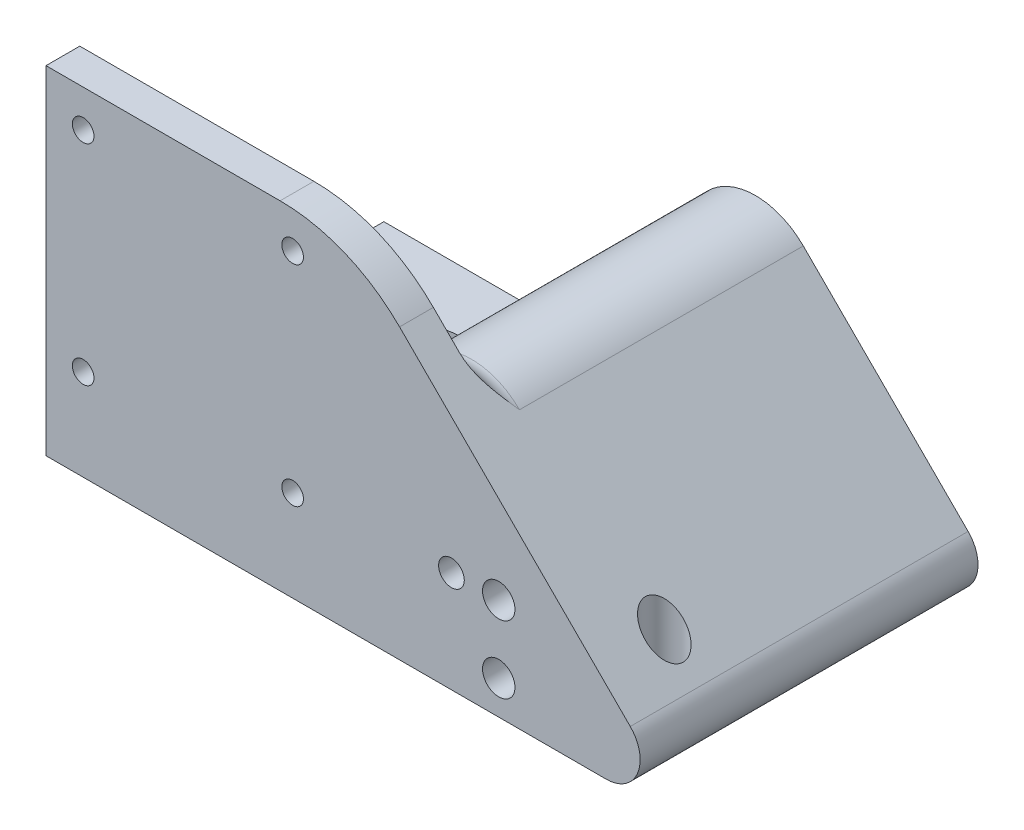
from build123d import *

# Parameters (mm, degrees)
SKETCH_1_R          = 1.6
SKETCH_1_R_2        = 12
EXTRUDE_1_DEPTH     = 5
SKETCH_4_W          = 45
SKETCH_4_H          = 50
SKETCH_4_R          = 1.6
EXTRUDE_4_DEPTH     = 5
SKETCH_5_W          = 50
SKETCH_5_H          = 50
EXTRUDE_5_DEPTH     = 50
SKETCH_6_R          = 2.4
SKETCH_6_R_2        = 1.9
CUT_EXTRUDE_1_DEPTH = 103.352332655
SKETCH_7_R          = 1.8
CUT_EXTRUDE_2_DEPTH = 94.898881782
SKETCH_8_R          = 2.8
CUT_EXTRUDE_3_DEPTH = 45
SKETCH_9_W          = 17
SKETCH_9_H          = 20
CUT_EXTRUDE_4_DEPTH = 45
CHAMFER_1_SIZE      = 50
FILLET_1_R          = 5
FILLET_4_R          = 10
FILLET_5_R          = 25
FILLET_6_R          = 3
FILLET_7_R          = 1.5


with BuildPart() as part:
    # 草图1 → 凸台-拉伸1 (new body)
    with BuildSketch(Plane(origin=(0, 0, 0), x_dir=(1, 0, 0), z_dir=(0, 1, 0))):
        Polygon((24, -24), (24, 21), (21, 21), (-21, 21), (-21, -21), (-21, -24), align=None)
        with Locations(Location((-15.5, 15.5, 0), (0, 0, 270))):
            Circle(SKETCH_1_R, mode=Mode.SUBTRACT)
        with Locations(Location((15.5, 15.5, 0), (0, 0, 270))):
            Circle(SKETCH_1_R, mode=Mode.SUBTRACT)
        with Locations(Location((-15.5, -15.5, 0), (0, 0, 270))):
            Circle(SKETCH_1_R, mode=Mode.SUBTRACT)
        with Locations(Location((15.5, -15.5, 0), (0, 0, 270))):
            Circle(SKETCH_1_R, mode=Mode.SUBTRACT)
        with Locations(Location((0, 0, 0), (0, 0, 270))):
            Circle(SKETCH_1_R_2, mode=Mode.SUBTRACT)
    extrude(amount=EXTRUDE_1_DEPTH)

    # 草图4 → 凸台-拉伸4 (add)
    with BuildSketch(Plane.XY.offset(24)):
        with Locations((1.5, 25)):
            Rectangle(SKETCH_4_W, SKETCH_4_H)
        with Locations((-15.5, 44.5)):
            Circle(SKETCH_4_R, mode=Mode.SUBTRACT)
        with Locations((15.5, 44.5)):
            Circle(SKETCH_4_R, mode=Mode.SUBTRACT)
        with Locations((-15.5, 13.5)):
            Circle(SKETCH_4_R, mode=Mode.SUBTRACT)
        with Locations((15.5, 13.5)):
            Circle(SKETCH_4_R, mode=Mode.SUBTRACT)
    extrude(amount=EXTRUDE_4_DEPTH)

    # 草图5 → 凸台-拉伸5 (add)
    with BuildSketch(Plane(origin=(24, 0, 0), x_dir=(0, 0, -1), z_dir=(1, 0, 0))):
        with Locations((-4, 25)):
            Rectangle(SKETCH_5_W, SKETCH_5_H)
    extrude(amount=EXTRUDE_5_DEPTH)

    # 草图6 → 切除-拉伸1 (cut, through all)
    with BuildSketch(Plane(origin=(0, 0, -21), x_dir=(-1, 0, 0), z_dir=(0, 0, -1))):
        with Locations((-46, 5)):
            Circle(SKETCH_6_R)
        with Locations((-46, 15)):
            Circle(SKETCH_6_R)
        with Locations((-39, 15)):
            Circle(SKETCH_6_R_2)
    extrude(amount=-CUT_EXTRUDE_1_DEPTH, mode=Mode.SUBTRACT)

    # 草图7 → 切除-拉伸2 (cut, through all)
    with BuildSketch(Plane.XZ):
        with Locations(Location((60.5, 19, 0), (0, 0, 270))):
            Circle(SKETCH_7_R)
    extrude(amount=-CUT_EXTRUDE_2_DEPTH, mode=Mode.SUBTRACT)

    # 草图8 → 切除-拉伸3 (cut)
    with BuildSketch(Plane(origin=(0, 50, 0), x_dir=(1, 0, 0), z_dir=(0, 1, 0))):
        with Locations(Location((60.5, -19, 0), (0, 0, 270))):
            Circle(SKETCH_8_R)
    extrude(amount=-CUT_EXTRUDE_3_DEPTH, mode=Mode.SUBTRACT)

    # 草图9 → 切除-拉伸4 (cut)
    with BuildSketch(Plane(origin=(0, 0, -21), x_dir=(-1, 0, 0), z_dir=(0, 0, -1))):
        with Locations((-42.5, 10)):
            Rectangle(SKETCH_9_W, SKETCH_9_H)
    extrude(amount=-CUT_EXTRUDE_4_DEPTH, mode=Mode.SUBTRACT)

    # 倒角1
    # the kernel refuses this chamfer: 50 mm, written as the material it takes off along each edge
    with BuildSketch(Plane(origin=(74, 50, 157.584149398), x_dir=(-0.9996219169112969, 0.027495876610586317, 0), z_dir=(0, 0, -1))) as chamfer_1_piece_1:
        Polygon((CHAMFER_1_SIZE * 0.999621916911, -CHAMFER_1_SIZE * 0.0274958766106), (-CHAMFER_1_SIZE * 0.0274958766106, -CHAMFER_1_SIZE * 0.999621916911), (0, 0), align=None)
    extrude(amount=307.168298797, mode=Mode.SUBTRACT)

    # 圆角1
    # the kernel refuses this fillet: 5 mm, written as the material it takes off along each edge
    with BuildSketch(Plane(origin=(74, 0, -51.17766953), x_dir=(-0.707106781186265, 0.7071067811868301, 0), z_dir=(0, 0, 1))) as fillet_1_piece_1:
        with BuildLine():
            CenterArc((FILLET_1_R * 2.41421356237, FILLET_1_R), FILLET_1_R, 135, 135)
            Line((FILLET_1_R * 1.70710678118, FILLET_1_R * 1.70710678119), (0, 0))
            Line((0, 0), (FILLET_1_R * 2.41421356237, 0))
        make_face()
    extrude(amount=110.355339059, mode=Mode.SUBTRACT)

    # 圆角4
    fillet_4_edges = [part.edges().sort_by_distance(p)[0] for p in [
        (24, 50, 1.5),
    ]]
    fillet(fillet_4_edges, radius=FILLET_4_R)

    # 圆角5
    fillet_5_edges = [part.edges().sort_by_distance(p)[0] for p in [
        (24, 50, 26.5),
    ]]
    fillet(fillet_5_edges, radius=FILLET_5_R)

    # 圆角6
    fillet_6_edges = [part.edges().sort_by_distance(p)[0] for p in [
        (30.173165676, 35.096659701, 24),
        (24, 15.428932188, 24),
        (1.5, 5, 24),
        (24, 5, 1.5),
        (34, 20, 1.5),
        (51, 20, 1.5),
    ]]
    fillet(fillet_6_edges, radius=FILLET_6_R)

    # 圆角7
    fillet_7_edges = [part.edges().sort_by_distance(p)[0] for p in [
        (51, 8.5, 24),
        (42.5, 20, 24),
        (34, 8.5, 24),
        (50.121320344, 19.121320344, 24),
        (34.878679656, 19.121320344, 24),
    ]]
    fillet(fillet_7_edges, radius=FILLET_7_R)


solid = part.part
